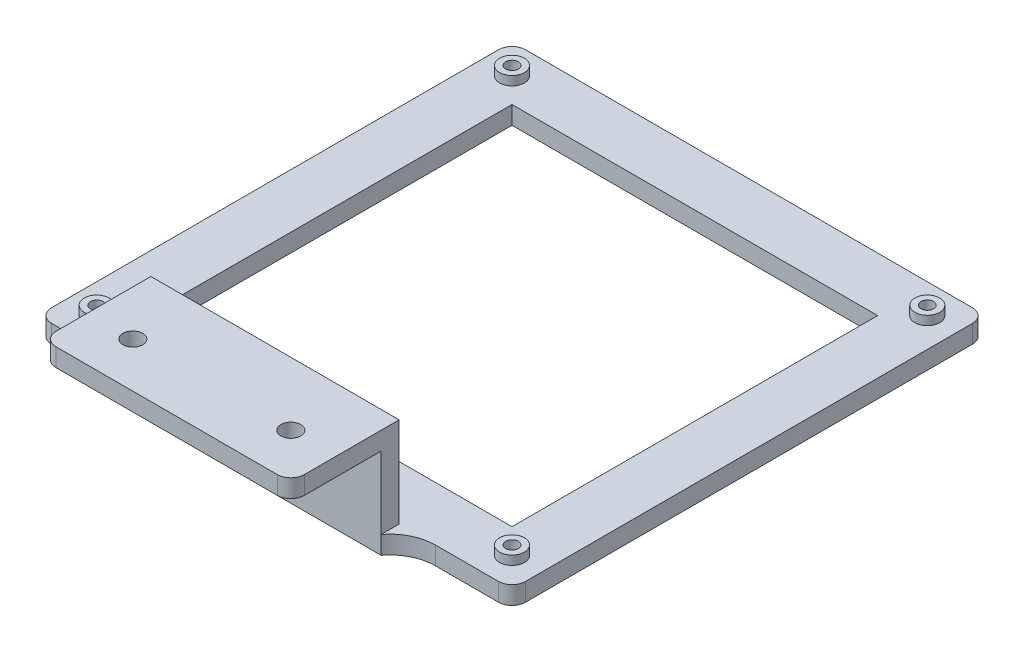
from build123d import *

# Parameters (mm, degrees)
SKETCH_1_W          = 105
SKETCH_1_H          = 105
SKETCH_1_R          = 2.75
SKETCH_1_W_2        = 81
SKETCH_1_H_2        = 81
SKETCH_1_R_2        = 1.4
EXTRUDE_1_DEPTH     = 4
EXTRUDE_START       = 4
SKETCH_1_4_R        = 2.75
SKETCH_1_4_R_2      = 1.4
EXTRUDE_2_DEPTH     = 2
EXTRUDE_START_2     = -25
EXTRUDE_3_DEPTH     = 55
CUT_EXTRUDE_1_REACH = 97.836
SKETCH_3_R          = 2.2
FILLET_1_R          = 3
FILLET_2_R          = 10


with BuildPart() as part:
    # 草图1 → 凸台-拉伸1 (new body)
    # profile 1 of 5: a face of its own
    with BuildSketch(Plane(origin=(0, 0, 0), x_dir=(1, 0, 0), z_dir=(0, 1, 0))):
        Rectangle(SKETCH_1_W, SKETCH_1_H)
        with Locations((46, 46)):
            Circle(SKETCH_1_R, mode=Mode.SUBTRACT)
        with Locations((-46, 46)):
            Circle(SKETCH_1_R, mode=Mode.SUBTRACT)
        with Locations((46, -46)):
            Circle(SKETCH_1_R, mode=Mode.SUBTRACT)
        with Locations((-46, -46)):
            Circle(SKETCH_1_R, mode=Mode.SUBTRACT)
        Rectangle(SKETCH_1_W_2, SKETCH_1_H_2, mode=Mode.SUBTRACT)
    # profile 2 of 5: a face of its own
    with BuildSketch(Plane(origin=(0, 0, 0), x_dir=(1, 0, 0), z_dir=(0, 1, 0))):
        with Locations((46, 46)):
            Circle(SKETCH_1_R)
        with Locations(Location((46, 46, 0), (0, 0, 270))):
            Circle(SKETCH_1_R_2, mode=Mode.SUBTRACT)
    # profile 3 of 5: a face of its own
    with BuildSketch(Plane(origin=(0, 0, 0), x_dir=(1, 0, 0), z_dir=(0, 1, 0))):
        with Locations((-46, 46)):
            Circle(SKETCH_1_R)
        with Locations(Location((-46, 46, 0), (0, 0, 270))):
            Circle(SKETCH_1_R_2, mode=Mode.SUBTRACT)
    # profile 4 of 5: a face of its own
    with BuildSketch(Plane(origin=(0, 0, 0), x_dir=(1, 0, 0), z_dir=(0, 1, 0))):
        with Locations((-46, -46)):
            Circle(SKETCH_1_R)
        with Locations(Location((-46, -46, 0), (0, 0, 270))):
            Circle(SKETCH_1_R_2, mode=Mode.SUBTRACT)
    # profile 5 of 5: a face of its own
    with BuildSketch(Plane(origin=(0, 0, 0), x_dir=(1, 0, 0), z_dir=(0, 1, 0))):
        with Locations((46, -46)):
            Circle(SKETCH_1_R)
        with Locations(Location((46, -46, 0), (0, 0, 270))):
            Circle(SKETCH_1_R_2, mode=Mode.SUBTRACT)
    extrude(amount=EXTRUDE_1_DEPTH)

    # 草图1<4> → 凸台-拉伸2 (add)
    # profile 1 of 4: a face of its own
    with BuildSketch(Plane(origin=(0, 0, 0), x_dir=(1, 0, 0), z_dir=(0, 1, 0)).offset(EXTRUDE_START)):
        with Locations(Location((-46, 46, 0), (0, 0, 270))):
            Circle(SKETCH_1_4_R)
        with Locations(Location((-46, 46, 0), (0, 0, 270))):
            Circle(SKETCH_1_4_R_2, mode=Mode.SUBTRACT)
    # profile 2 of 4: a face of its own
    with BuildSketch(Plane(origin=(0, 0, 0), x_dir=(1, 0, 0), z_dir=(0, 1, 0)).offset(EXTRUDE_START)):
        with Locations(Location((46, 46, 0), (0, 0, 270))):
            Circle(SKETCH_1_4_R)
        with Locations(Location((46, 46, 0), (0, 0, 270))):
            Circle(SKETCH_1_4_R_2, mode=Mode.SUBTRACT)
    # profile 3 of 4: a face of its own
    with BuildSketch(Plane(origin=(0, 0, 0), x_dir=(1, 0, 0), z_dir=(0, 1, 0)).offset(EXTRUDE_START)):
        with Locations(Location((46, -46, 0), (0, 0, 270))):
            Circle(SKETCH_1_4_R)
        with Locations(Location((46, -46, 0), (0, 0, 270))):
            Circle(SKETCH_1_4_R_2, mode=Mode.SUBTRACT)
    # profile 4 of 4: a face of its own
    with BuildSketch(Plane(origin=(0, 0, 0), x_dir=(1, 0, 0), z_dir=(0, 1, 0)).offset(EXTRUDE_START)):
        with Locations(Location((-46, -46, 0), (0, 0, 270))):
            Circle(SKETCH_1_4_R)
        with Locations(Location((-46, -46, 0), (0, 0, 270))):
            Circle(SKETCH_1_4_R_2, mode=Mode.SUBTRACT)
    extrude(amount=EXTRUDE_2_DEPTH)

    # 草图2 → 凸台-拉伸3 (add)
    with BuildSketch(Plane.ZY.offset(52.5).offset(EXTRUDE_START_2)):
        Polygon((52.5, 0), (56.5, 0), (56.5, 20), (76.5, 20), (76.5, 24), (52.5, 24), align=None)
    extrude(amount=-EXTRUDE_3_DEPTH)

    # 草图3 → 切除-拉伸1 (cut, up to next)
    with BuildSketch(Plane(origin=(0, 24, 0), x_dir=(1, 0, 0), z_dir=(0, 1, 0)), mode=Mode.PRIVATE) as cut_extrude_1_sk1:
        with Locations(Location((17.5, -66.5, 0), (0, 0, 270))):
            Circle(SKETCH_3_R)
    cut_extrude_1_tool1 = extrude(cut_extrude_1_sk1.sketch, amount=-CUT_EXTRUDE_1_REACH, mode=Mode.PRIVATE) & part.part
    # 草图3 → 切除-拉伸1 (cut, up to next)
    with BuildSketch(Plane(origin=(0, 24, 0), x_dir=(1, 0, 0), z_dir=(0, 1, 0)), mode=Mode.PRIVATE) as cut_extrude_1_sk2:
        with Locations(Location((-17.5, -66.5, 0), (0, 0, 270))):
            Circle(SKETCH_3_R)
    cut_extrude_1_tool2 = extrude(cut_extrude_1_sk2.sketch, amount=-CUT_EXTRUDE_1_REACH, mode=Mode.PRIVATE) & part.part
    add(cut_extrude_1_tool1.solids().sort_by_distance((17.5, 24, 66.5))[0], mode=Mode.SUBTRACT)
    add(cut_extrude_1_tool2.solids().sort_by_distance((-17.5, 24, 66.5))[0], mode=Mode.SUBTRACT)

    # 圆角1
    fillet_1_edges = [part.edges().sort_by_distance(p)[0] for p in [
        (-52.5, 2, -52.5),
        (52.5, 2, -52.5),
        (52.5, 2, 52.5),
        (27.5, 22, 76.5),
        (-27.5, 22, 76.5),
        (-52.5, 2, 52.5),
    ]]
    fillet(fillet_1_edges, radius=FILLET_1_R)

    # 圆角2
    # the kernel refuses this fillet: 10 mm, written as the material it adds along each edge
    with BuildSketch(Plane(origin=(27.5, 4, 52.5), x_dir=(1, 0, 0), z_dir=(0, -1, 0))) as fillet_2_piece_1:
        with BuildLine():
            CenterArc((8, 10), FILLET_2_R, 216.869897646, 53.130102354)
            Line((0, 4), (0, 0))
            Line((0, 0), (8, 0))
        make_face()
    extrude(amount=4)
    with BuildSketch(Plane(origin=(-27.5, 4, 52.5), x_dir=(0, 0, 1), z_dir=(0, -1, 0))) as fillet_2_piece_2:
        with BuildLine():
            CenterArc((10, 8), FILLET_2_R, 180, 53.130102354)
            Line((0, 8), (0, 0))
            Line((0, 0), (4, 0))
        make_face()
    extrude(amount=4)


solid = part.part
